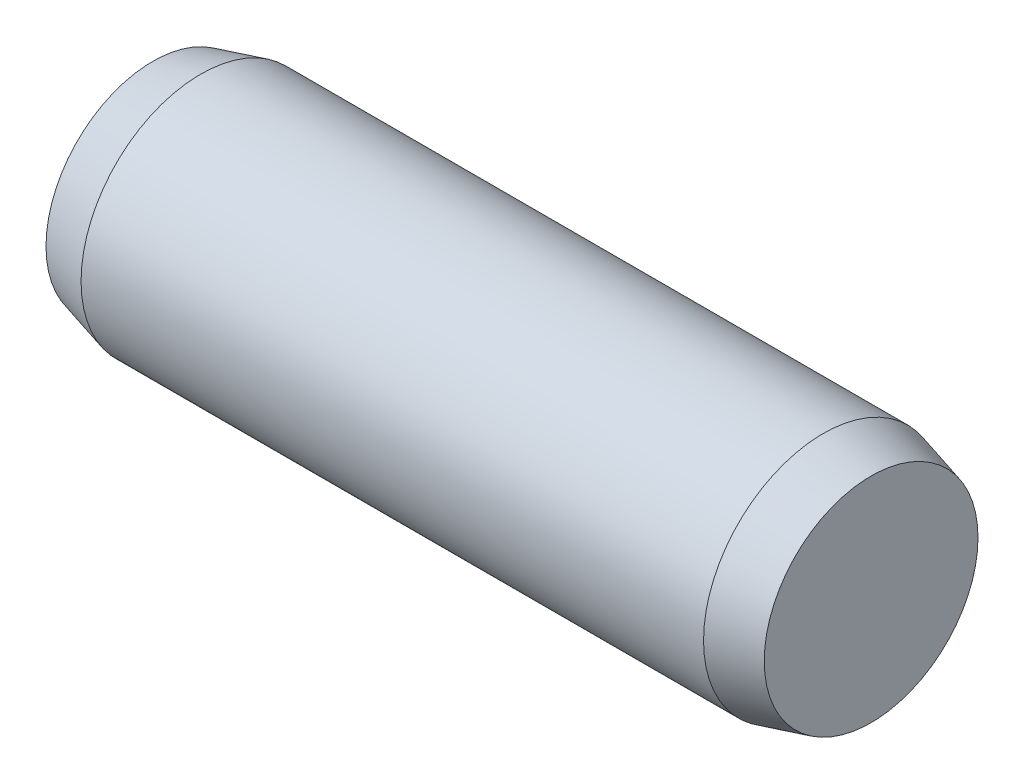
from build123d import *


with BuildPart() as part:
    # BodySke → BaseBody (revolve)
    with BuildSketch(Plane(origin=(0, 0, 0), x_dir=(1, 0, 0), z_dir=(0, 1, 0))):
        Polygon((0, 0), (30, 0), (30, 4.464101615), (28, 5), (2, 5), (0, 4.464101615), align=None)
    revolve(axis=Axis((0, 0, 0), (1, 0, 0)))


solid = part.part
